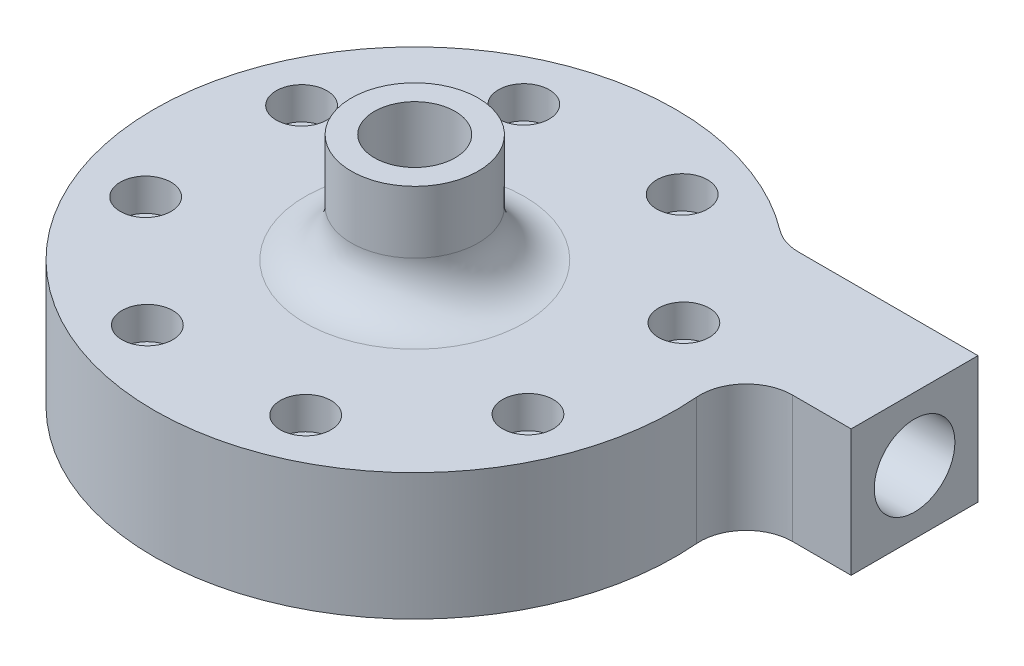
from build123d import *

# Parameters (mm, degrees)
MAIN_BODY_DEPTH           = 27.4625
SKETCH5_R                 = 2.9765625
BOLT_CLEARANCES_DEPTH     = 101.858615827
SKETCH6_R                 = 5.5
BOLT_HEAD_CLEARANCE_DEPTH = 7


with BuildPart() as part:
    # Sketch1 → main body (new body)
    with BuildSketch(Plane(origin=(0, 0, 0), x_dir=(1, 0, 0), z_dir=(0, 1, 0))):
        with BuildLine():
            Line((78.940920787, 29.260248187), (78.940920787, 42.991498187))
            Line((78.940920787, 42.991498187), (40.093685537, 42.991498187))
            ThreePointArc((40.093685537, 42.991498187), (36.91142401, 43.511349898), (34.060023304, 45.016855871))
            ThreePointArc((34.060023304, 45.016855871), (-49.452917381, -27.221525719), (56.254255078, 4.696944284))
            ThreePointArc((56.254255078, 4.696944284), (58.860213164, 12.299502635), (66.219579273, 15.528998187))
            Line((66.219579273, 15.528998187), (78.940920787, 15.528998187))
            Line((78.940920787, 15.528998187), (78.940920787, 29.260248187))
        make_face()
    extrude(amount=MAIN_BODY_DEPTH)

    # Sketch2 → main chamber (revolve, cut)
    with BuildSketch(Plane.XY):
        Polygon((0, 27.4625), (5.4102, 27.4625), (5.4102, 25.933062512), (30.626685, 15.276115454), (30.626685, 0), (0, 0), align=None)
    revolve(axis=Axis((0, 0, 0), (0, 1, 0)), mode=Mode.SUBTRACT)

    # Sketch4 → inlet (revolve)
    with BuildSketch(Plane.XY):
        with BuildLine():
            Line((5.4102, 27.4625), (5.4102, 35.933062512))
            Line((5.4102, 35.933062512), (8.73125, 35.933062512))
            Line((8.73125, 35.933062512), (8.73125, 50.933062512))
            Line((8.73125, 50.933062512), (13.73125, 50.933062512))
            Line((13.73125, 50.933062512), (13.73125, 37.4625))
            ThreePointArc((13.73125, 37.4625), (16.660182188, 30.391432188), (23.73125, 27.4625))
            Line((23.73125, 27.4625), (5.4102, 27.4625))
        make_face()
    revolve(axis=Axis((0, 0, 0), (0, 1, 0)))

    # Sketch3 → expansion cone and outlet (revolve, cut)
    with BuildSketch(Plane(origin=(0, 13.73125, 0), x_dir=(1, 0, 0), z_dir=(0, 1, 0))):
        Polygon((2.669291479, 30.510141217), (60.940920787, 35.608248187), (60.940920787, 37.991498187), (78.940920787, 37.991498187), (78.940920787, 29.260248187), (60.940920787, 29.260248187), (2.559940008, 29.260248187), align=None)
    revolve(axis=Axis((60.940920787, 13.73125, -29.260248187), (-1, 0, 0)), mode=Mode.SUBTRACT)

    # Sketch5 → bolt clearances (cut, through all)
    with BuildSketch(Plane(origin=(0, 27.4625, 0), x_dir=(1, 0, 0), z_dir=(0, 1, 0))):
        with Locations((40.934758669, 17.324780886)):
            Circle(SKETCH5_R)
        with Locations((41.195715488, -16.694775394)):
            Circle(SKETCH5_R)
        with Locations((17.324780886, -40.934758669)):
            Circle(SKETCH5_R)
        with Locations((-16.694775394, -41.195715488)):
            Circle(SKETCH5_R)
        with Locations((-40.934758669, -17.324780886)):
            Circle(SKETCH5_R)
        with Locations((-41.195715488, 16.694775394)):
            Circle(SKETCH5_R)
        with Locations((-17.324780886, 40.934758669)):
            Circle(SKETCH5_R)
        with Locations((16.694775394, 41.195715488)):
            Circle(SKETCH5_R)
    extrude(amount=-BOLT_CLEARANCES_DEPTH, mode=Mode.SUBTRACT)

    # Sketch6 → bolt head clearance (cut)
    with BuildSketch(Plane(origin=(0, 27.4625, 0), x_dir=(1, 0, 0), z_dir=(0, 1, 0))):
        with Locations((40.934758669, 17.324780886)):
            Circle(SKETCH6_R)
        with Locations((41.195715488, -16.694775394)):
            Circle(SKETCH6_R)
        with Locations((17.324780886, -40.934758669)):
            Circle(SKETCH6_R)
        with Locations((-16.694775394, -41.195715488)):
            Circle(SKETCH6_R)
        with Locations((-40.934758669, -17.324780886)):
            Circle(SKETCH6_R)
        with Locations((-41.195715488, 16.694775394)):
            Circle(SKETCH6_R)
        with Locations((-17.324780886, 40.934758669)):
            Circle(SKETCH6_R)
        with Locations((16.694775394, 41.195715488)):
            Circle(SKETCH6_R)
    extrude(amount=-BOLT_HEAD_CLEARANCE_DEPTH, mode=Mode.SUBTRACT)


solid = part.part
